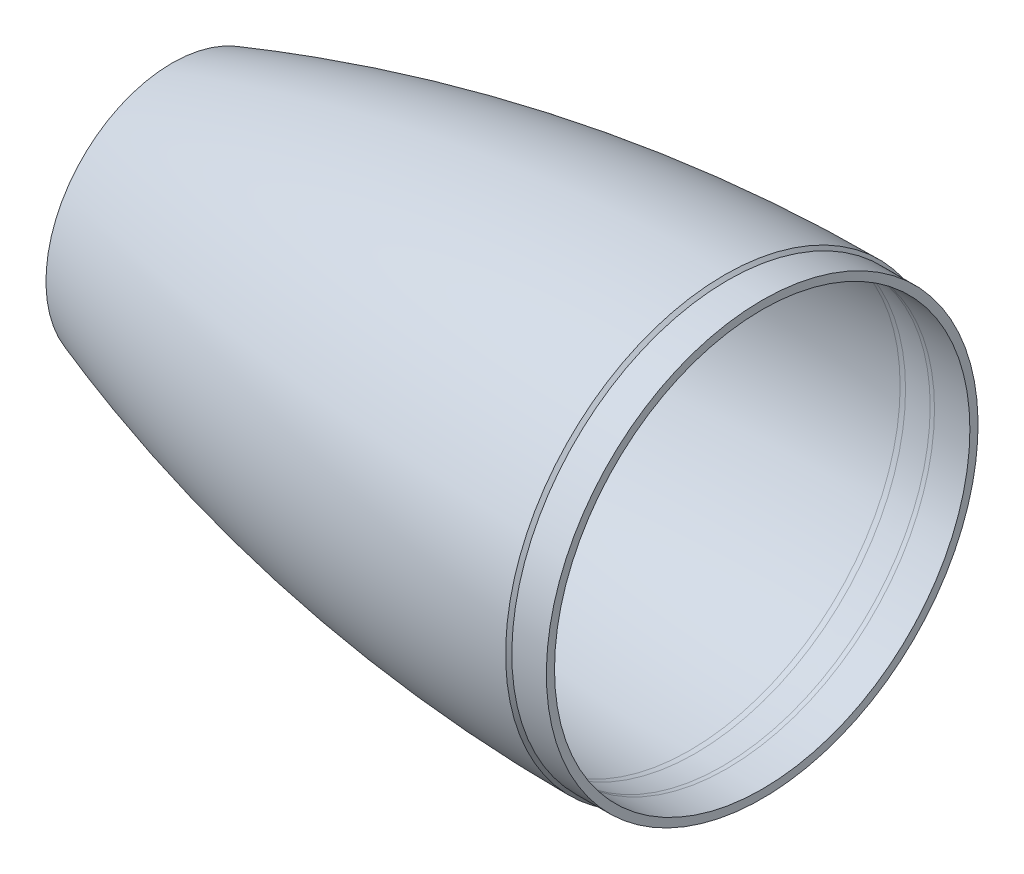
from build123d import *


with BuildPart() as part:
    # Sketch1 → Revolve1 (revolve)
    with BuildSketch(Plane.XY):
        with BuildLine():
            Line((-203.2, 46.355), (-203.2, 41.4655))
            Line((-203.2, 41.4655), (-181.891046497, 41.4655))
            ThreePointArc((-181.891046497, 41.4655), (-177.891194767, 41.890149369), (-174.06966687, 43.145165497))
            Line((-174.06966687, 43.145165497), (-128.900346892, 63.483656905))
            ThreePointArc((-128.900346892, 63.483656905), (-126.949251882, 64.236298386), (-124.927415644, 64.770544732))
            ThreePointArc((-124.927415644, 64.770544732), (-69.161601869, 73.641105762), (-12.819129096, 77.387917852))
            ThreePointArc((-12.819129096, 77.387917852), (-11.790597396, 77.38147064), (-10.763912836, 77.319520348))
            Line((-10.763912836, 77.319520348), (-0.828575937, 76.450291001))
            ThreePointArc((-0.828575937, 76.450291001), (0.000791633, 76.395931379), (0.831740962, 76.3778))
            Line((0.831740962, 76.3778), (13.843, 76.3778))
            Line((13.843, 76.3778), (13.843, 79.375))
            Line((13.843, 79.375), (1.143, 79.375))
            Line((1.143, 79.375), (0, 80.518))
            ThreePointArc((0, 80.518), (-103.025907626, 71.917734953), (-203.2, 46.355))
        make_face()
    revolve(axis=Axis((0, 0, 0), (-1, 0, 0)))


solid = part.part
